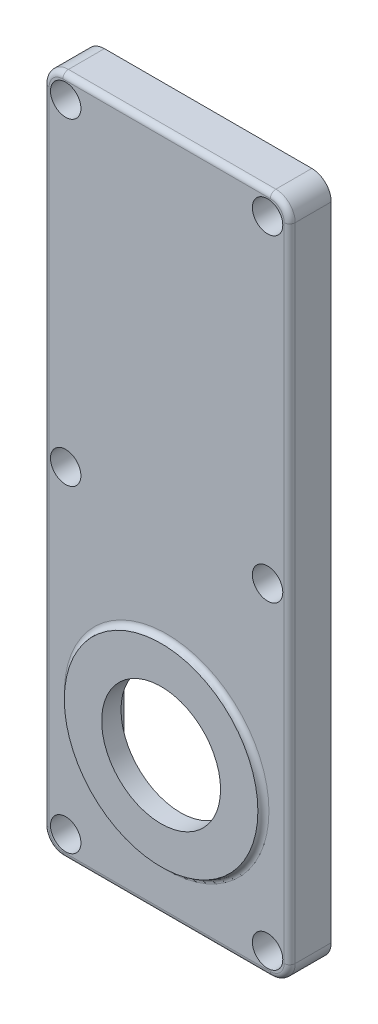
from build123d import *

# Parameters (mm, degrees)
EXTRUDE_1_DEPTH           = 15
SKETCH_2_R                = 35
EXTRUDE_2_DEPTH           = 2
FILLET_1_R                = 2
HOLE_WIZARD_M48_1_D       = 43
CUT_EXTRUDE_1_DEPTH       = 10
FILLET_2_R                = 2
HOLE_START                = 7
HOLE_WIZARD_1_OUTLINE_R   = 5.5
HOLE_WIZARD_1_DEPTH       = 8
HOLE_WIZARD_1_2_OUTLINE_R = 3.3
HOLE_WIZARD_1_2_DEPTH     = 7


# Read off the part's stored shape, not the designer's step: 孔1
with BuildPart() as part:
    # 草图1 → 凸台-拉伸1 (new body)
    with BuildSketch(Plane.XY):
        with BuildLine():
            Line((-37.5, -123), (37.5, -123))
            ThreePointArc((37.5, -123), (42.449747468, -120.949747468), (44.5, -116))
            Line((44.5, -116), (44.5, 116))
            ThreePointArc((44.5, 116), (42.449747468, 120.949747468), (37.5, 123))
            Line((37.5, 123), (-37.5, 123))
            ThreePointArc((-37.5, 123), (-42.449747468, 120.949747468), (-44.5, 116))
            Line((-44.5, 116), (-44.5, -116))
            ThreePointArc((-44.5, -116), (-42.449747468, -120.949747468), (-37.5, -123))
        make_face()
    extrude(amount=EXTRUDE_1_DEPTH)

    # 草图2 → 凸台-拉伸2 (add)
    with BuildSketch(Plane.XY.offset(15)):
        with Locations((0, -71)):
            Circle(SKETCH_2_R)
    extrude(amount=EXTRUDE_2_DEPTH)

    # 圆角1
    fillet_1_edges = [part.edges().sort_by_distance(p)[0] for p in [
        (42.449747468, 120.949747468, 15),
        (0, 123, 15),
        (-42.449747468, 120.949747468, 15),
        (-44.5, 0, 15),
        (-35, -71, 15),
        (-42.449747468, -120.949747468, 15),
        (0, -123, 15),
        (42.449747468, -120.949747468, 15),
        (44.5, 0, 15),
    ]]
    fillet(fillet_1_edges, radius=FILLET_1_R - 0.0001)  # a hair under: the kernel refuses the full size

    # M48 螺纹孔1 (through all)
    with Locations(Plane.XY.offset(17)):
        with Locations((0, -71)):
            Hole(HOLE_WIZARD_M48_1_D / 2)

    # 草图5 → 切除-拉伸1 (cut)
    with BuildSketch(Plane(origin=(0, 0, 0), x_dir=(-1, 0, 0), z_dir=(0, 0, -1))):
        with BuildLine():
            Line((-25.5, -109), (25.5, -109))
            ThreePointArc((25.5, -109), (29.035533906, -107.535533906), (30.5, -104))
            Line((30.5, -104), (30.5, 104))
            ThreePointArc((30.5, 104), (29.035533906, 107.535533906), (25.5, 109))
            Line((25.5, 109), (-25.5, 109))
            ThreePointArc((-25.5, 109), (-29.035533906, 107.535533906), (-30.5, 104))
            Line((-30.5, 104), (-30.5, -104))
            ThreePointArc((-30.5, -104), (-29.035533906, -107.535533906), (-25.5, -109))
        make_face()
    extrude(amount=-CUT_EXTRUDE_1_DEPTH, mode=Mode.SUBTRACT)

    # 圆角2
    fillet_2_edges = [part.edges().sort_by_distance(p)[0] for p in [
        (-29.035533906, -107.535533906, 10),
        (0, -109, 10),
        (29.035533906, -107.535533906, 10),
        (30.5, 0, 10),
        (29.035533906, 107.535533906, 10),
        (0, 109, 10),
        (-29.035533906, 107.535533906, 10),
        (-30.5, 0, 10),
    ]]
    fillet(fillet_2_edges, radius=FILLET_2_R)

    # 孔1 outline → 孔1 (cut)
    with BuildSketch(Plane.XY.offset(HOLE_START)):
        with Locations((36.5, 0)):
            Circle(HOLE_WIZARD_1_OUTLINE_R)
        with Locations((-36.5, 0)):
            Circle(HOLE_WIZARD_1_OUTLINE_R)
        with Locations((36.5, -115)):
            Circle(HOLE_WIZARD_1_OUTLINE_R)
        with Locations((-36.5, 115)):
            Circle(HOLE_WIZARD_1_OUTLINE_R)
        with Locations((-36.5, -115)):
            Circle(HOLE_WIZARD_1_OUTLINE_R)
        with Locations((36.5, 115)):
            Circle(HOLE_WIZARD_1_OUTLINE_R)
    extrude(amount=HOLE_WIZARD_1_DEPTH, mode=Mode.SUBTRACT)

    # Hole Wizard 1 2 outline → Hole Wizard 1 2 (cut)
    with BuildSketch(Plane.XY):
        with Locations((36.5, 0)):
            Circle(HOLE_WIZARD_1_2_OUTLINE_R)
        with Locations((-36.5, 0)):
            Circle(HOLE_WIZARD_1_2_OUTLINE_R)
        with Locations((36.5, -115)):
            Circle(HOLE_WIZARD_1_2_OUTLINE_R)
        with Locations((-36.5, 115)):
            Circle(HOLE_WIZARD_1_2_OUTLINE_R)
        with Locations((-36.5, -115)):
            Circle(HOLE_WIZARD_1_2_OUTLINE_R)
        with Locations((36.5, 115)):
            Circle(HOLE_WIZARD_1_2_OUTLINE_R)
    extrude(amount=HOLE_WIZARD_1_2_DEPTH, mode=Mode.SUBTRACT)


solid = part.part
